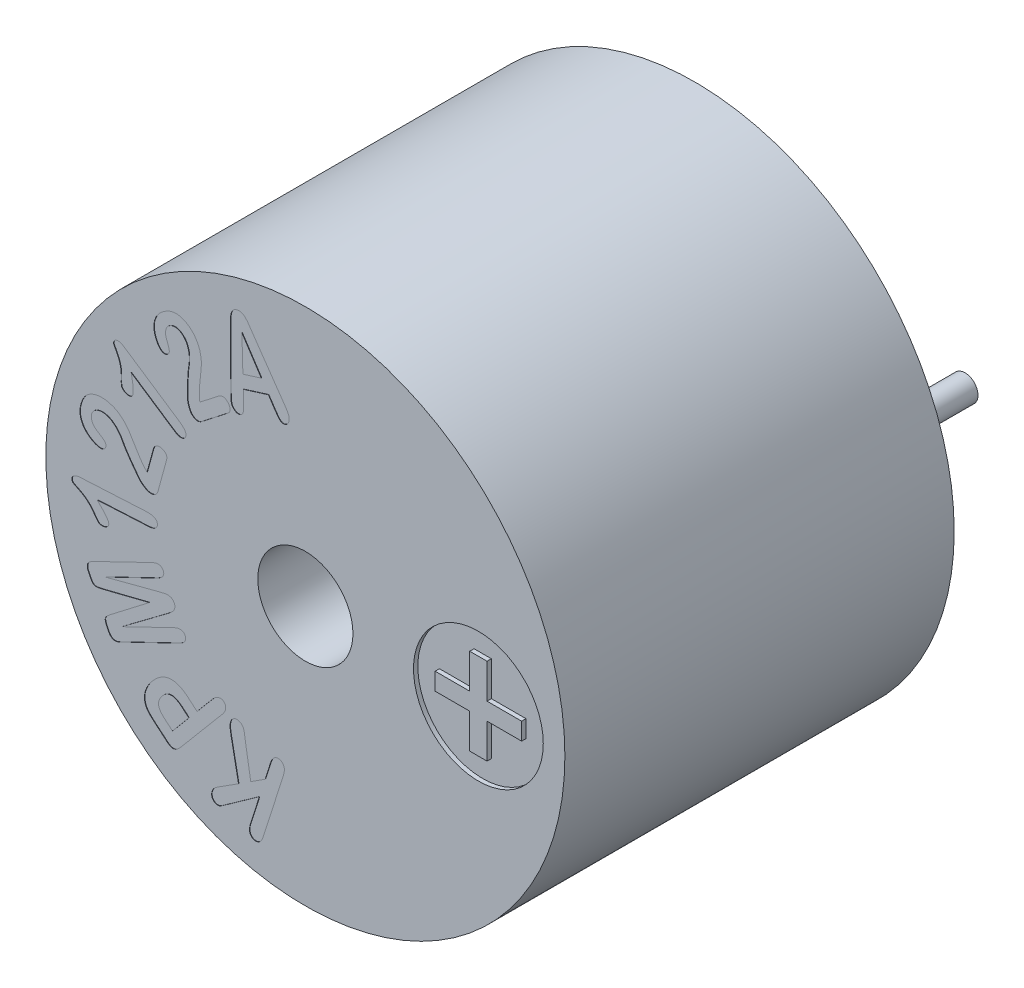
from build123d import *

# Parameters (mm, degrees)
SKETCH_1_R              = 6
SKETCH_1_R_2            = 5
EXTRUDE_1_DEPTH         = 0.5
EXTRUDE_START           = 0.5
SKETCH_1_3_R            = 6
EXTRUDE_2_DEPTH         = 8.5
CUT_EXTRUDE_START       = 9
SKETCH_1_4_R            = 1.1
CUT_EXTRUDE_1_DEPTH     = 3
EXTRUDE_3_DEPTH         = 0.5
EXTRUDE_3_DEPTH_BACK    = 3
SKETCH_2_R              = 0.3
EXTRUDE_3_2_DEPTH       = 0.5
EXTRUDE_3_2_DEPTH_BACK  = 3
CUT_EXTRUDE_START_2     = 8.9
CUT_EXTRUDE_2_OUTLINE_R = 1.5
CUT_EXTRUDE_2_DEPTH     = 0.1
WRAP_START              = 8.99
WRAP_1_DEPTH            = 0.01


# Read off the part's stored shape, not the designer's step: Вырез-Вытянуть2, Перенос1
with BuildPart() as part:
    # Эскиз1 → Бобышка-Вытянуть1 (new body)
    with BuildSketch(Plane.XY):
        Circle(SKETCH_1_R)
        Circle(SKETCH_1_R_2, mode=Mode.SUBTRACT)
    extrude(amount=EXTRUDE_1_DEPTH)

    # Эскиз1<3> → Бобышка-Вытянуть2 (add)
    with BuildSketch(Plane.XY.offset(EXTRUDE_START)):
        Circle(SKETCH_1_3_R)
    extrude(amount=EXTRUDE_2_DEPTH)

    # Эскиз1<4> → Вырез-Вытянуть1 (cut)
    with BuildSketch(Plane.XY.offset(CUT_EXTRUDE_START)):
        Circle(SKETCH_1_4_R)
    extrude(amount=-CUT_EXTRUDE_1_DEPTH, mode=Mode.SUBTRACT)

    # Вырез-Вытянуть2 outline → Вырез-Вытянуть2 (cut)
    with BuildSketch(Plane.XY.offset(CUT_EXTRUDE_START_2)):
        with Locations((4, 0)):
            Circle(CUT_EXTRUDE_2_OUTLINE_R)
        Polygon((3, 0.2), (3.8, 0.2), (3.8, 1), (4.2, 1), (4.2, 0.2), (5, 0.2), (5, -0.2), (4.2, -0.2), (4.2, -1), (3.8, -1), (3.8, -0.2), (3, -0.2), align=None, mode=Mode.SUBTRACT)
    extrude(amount=CUT_EXTRUDE_2_DEPTH, mode=Mode.SUBTRACT)

    # Перенос1 outline → Перенос1 (cut)
    # profile 1 of 8: a face of its own
    with BuildSketch(Plane.XY.offset(WRAP_START)):
        with BuildLine():
            add(Edge.make_bspline(
                [(-1.428605394, 3.36679184), (-1.428449227, 3.354682746), (-1.428148656, 3.331376643), (-1.4281313, 3.297909794), (-1.428553274, 3.267310229), (-1.429139913, 3.239685942), (-1.430804785, 3.214946984), (-1.432693406, 3.193190317), (-1.434925091, 3.174253639), (-1.438761833, 3.153542847), (-1.446833689, 3.130896779), (-1.463354686, 3.108057862), (-1.487208656, 3.090856597), (-1.50586995, 3.083797263), (-1.515714769, 3.08007309)],
                knots=[0, 0, 0, 0, 0.111882552, 0.215337857, 0.309177123, 0.394621777, 0.470561407, 0.538195639, 0.596387499, 0.646639346, 0.732666325, 0.816157896, 0.903013566, 1, 1, 1, 1], degree=3))
            Line((-1.428605394, 3.36679184), (-1.434855394, 3.626557465))
            Line((-1.434855394, 3.626557465), (-0.853996019, 3.80741684))
            Line((-0.853996019, 3.80741684), (-0.713371019, 3.595307465))
            add(Edge.make_bspline(
                [(-0.470402269, 3.40585434), (-0.481258824, 3.403037119), (-0.502084122, 3.397633059), (-0.53418255, 3.401619184), (-0.562660273, 3.414651715), (-0.585041676, 3.430131483), (-0.602233221, 3.447112163), (-0.616603302, 3.463855261), (-0.633068003, 3.483542315), (-0.655535003, 3.514150775), (-0.682599454, 3.551660731), (-0.703628437, 3.581488477), (-0.713371019, 3.595307465)],
                knots=[0, 0, 0, 0, 0.100723766, 0.193210704, 0.285547501, 0.381949588, 0.437760874, 0.503692542, 0.581515187, 0.669858793, 0.847047871, 1, 1, 1, 1], degree=3))
            add(Edge.make_bspline(
                [(-0.382121019, 3.61991684), (-0.379392544, 3.609304548), (-0.373963416, 3.588188173), (-0.372673952, 3.555349296), (-0.376603793, 3.522199774), (-0.386324907, 3.489971488), (-0.400029958, 3.459964121), (-0.419282038, 3.435547578), (-0.442571877, 3.416381412), (-0.461022137, 3.409402452), (-0.470402269, 3.40585434)],
                knots=[0, 0, 0, 0, 0.128587242, 0.255863317, 0.383911215, 0.519617438, 0.65046537, 0.769354858, 0.882739756, 1, 1, 1, 1], degree=3))
            add(Edge.make_bspline(
                [(-0.487199144, 3.803119965), (-0.474102972, 3.784239329), (-0.449941858, 3.749406465), (-0.419660786, 3.699778568), (-0.396113555, 3.658189334), (-0.386403105, 3.631629236), (-0.382121019, 3.61991684)],
                knots=[0, 0, 0, 0, 0.325275177, 0.600099818, 0.823653169, 1, 1, 1, 1], degree=3))
            Line((-0.487199144, 3.803119965), (-1.229777269, 4.872651215))
            add(Edge.make_bspline(
                [(-1.589542894, 5.141401215), (-1.579713155, 5.144186494), (-1.560806479, 5.149543742), (-1.532148848, 5.15231906), (-1.504938929, 5.150432166), (-1.479200596, 5.143933139), (-1.455014038, 5.134088521), (-1.4321272, 5.1214143), (-1.410490081, 5.106100811), (-1.383479799, 5.081720051), (-1.351703677, 5.047278402), (-1.322300062, 5.008855266), (-1.298871887, 4.974025629), (-1.2779856, 4.943943104), (-1.25467164, 4.909701799), (-1.238357253, 4.885420905), (-1.229777269, 4.872651215)],
                knots=[0, 0, 0, 0, 0.062873549, 0.120931978, 0.176455405, 0.230180524, 0.283833658, 0.33699834, 0.391111716, 0.446832015, 0.560971045, 0.679441093, 0.744667931, 0.819691191, 0.905172866, 1, 1, 1, 1], degree=3))
            add(Edge.make_bspline(
                [(-1.729777269, 4.71444809), (-1.730067759, 4.735021245), (-1.730702033, 4.779942038), (-1.73096359, 4.837488478), (-1.730979269, 4.886224286), (-1.728734386, 4.92124455), (-1.72633073, 4.95349311), (-1.721993506, 4.982992153), (-1.716136528, 5.010452461), (-1.706276027, 5.035445041), (-1.69516314, 5.059338801), (-1.680668103, 5.081270432), (-1.662968542, 5.10096052), (-1.641948858, 5.11815017), (-1.617123633, 5.131815613), (-1.598896183, 5.138150508), (-1.589542894, 5.141401215)],
                knots=[0, 0, 0, 0, 0.126739608, 0.276731677, 0.354538072, 0.426837051, 0.492847246, 0.553647206, 0.610459527, 0.665283676, 0.718735295, 0.772570687, 0.826525448, 0.881267392, 0.939073197, 1, 1, 1, 1], degree=3))
            Line((-1.729777269, 4.71444809), (-1.723527269, 3.407026215))
            add(Edge.make_bspline(
                [(-1.706339769, 3.20507309), (-1.709785069, 3.21802872), (-1.716808151, 3.244438164), (-1.720721243, 3.279591235), (-1.722108353, 3.310790916), (-1.722742065, 3.339057703), (-1.723764961, 3.371603406), (-1.723609406, 3.39478558), (-1.723527269, 3.407026215)],
                knots=[0, 0, 0, 0, 0.197480304, 0.402554355, 0.519832606, 0.658145621, 0.819494301, 1, 1, 1, 1], degree=3))
            add(Edge.make_bspline(
                [(-1.515714769, 3.08007309), (-1.524776616, 3.077878689), (-1.543024596, 3.073459791), (-1.571833332, 3.076028492), (-1.600773193, 3.085017296), (-1.629046104, 3.100581943), (-1.655072116, 3.121319857), (-1.677417577, 3.145870466), (-1.694990887, 3.173933258), (-1.702531392, 3.194623407), (-1.706339769, 3.20507309)],
                knots=[0, 0, 0, 0, 0.110912716, 0.223346641, 0.340629655, 0.471672739, 0.606944102, 0.737095221, 0.867218368, 1, 1, 1, 1], degree=3))
        make_face()
        Polygon((-1.466886644, 4.74101059), (-1.017667894, 4.057807465), (-1.444230394, 3.924994965), align=None, mode=Mode.SUBTRACT)
    # profile 2 of 8: a face of its own
    with BuildSketch(Plane.XY.offset(WRAP_START)):
        with BuildLine():
            add(Edge.make_bspline(
                [(-4.026173614, 2.662677904), (-4.020107979, 2.633419608), (-4.008653457, 2.578167381), (-3.99556939, 2.499411371), (-3.985351965, 2.429926848), (-3.979678779, 2.369443917), (-3.97815223, 2.318081625), (-3.980709027, 2.276036347), (-3.986084248, 2.242261544), (-3.994949615, 2.224401325), (-3.998829864, 2.216584154)],
                knots=[0, 0, 0, 0, 0.197915371, 0.373749199, 0.528788604, 0.663026882, 0.776049531, 0.86853883, 0.942461261, 1, 1, 1, 1], degree=3))
            Line((-4.026173614, 2.662677904), (-3.028907989, 1.997443529))
            add(Edge.make_bspline(
                [(-2.776954864, 1.990412279), (-2.782800373, 1.982591149), (-2.79417269, 1.967375301), (-2.818219826, 1.95128516), (-2.845699488, 1.941474843), (-2.876958689, 1.938036274), (-2.911390147, 1.941889987), (-2.948453715, 1.953596387), (-2.988680648, 1.971593969), (-3.014930994, 1.988462096), (-3.028907989, 1.997443529)],
                knots=[0, 0, 0, 0, 0.103247739, 0.200866345, 0.302549706, 0.411338273, 0.532522872, 0.668418114, 0.823449232, 1, 1, 1, 1], degree=3))
            add(Edge.make_bspline(
                [(-2.922267364, 2.251349779), (-2.90513232, 2.239521882), (-2.873090572, 2.217404256), (-2.831213849, 2.182244897), (-2.798626727, 2.147950079), (-2.77527626, 2.114456074), (-2.760593892, 2.081881893), (-2.755829067, 2.04965672), (-2.760899126, 2.018019489), (-2.771500887, 1.999790178), (-2.776954864, 1.990412279)],
                knots=[0, 0, 0, 0, 0.187645064, 0.350887666, 0.492094085, 0.61289707, 0.717563266, 0.811200165, 0.902873684, 1, 1, 1, 1], degree=3))
            Line((-2.922267364, 2.251349779), (-4.181642364, 3.091584154))
            add(Edge.make_bspline(
                [(-4.416017364, 3.107599779), (-4.410758841, 3.114201869), (-4.400293329, 3.127341349), (-4.378260676, 3.140939349), (-4.352161225, 3.147907223), (-4.322614342, 3.148669783), (-4.289990394, 3.143789719), (-4.255156527, 3.132546687), (-4.218420777, 3.114945296), (-4.19437399, 3.099671108), (-4.181642364, 3.091584154)],
                knots=[0, 0, 0, 0, 0.096819302, 0.192689774, 0.292572897, 0.405341812, 0.531336226, 0.671509548, 0.826079977, 1, 1, 1, 1], degree=3))
            add(Edge.make_bspline(
                [(-4.255470489, 2.434943529), (-4.254904875, 2.458771642), (-4.253810037, 2.504894853), (-4.257203186, 2.571899927), (-4.265448801, 2.634154515), (-4.27759081, 2.69240857), (-4.294117142, 2.747835438), (-4.313562224, 2.802137908), (-4.336732297, 2.855851933), (-4.358689237, 2.899296267), (-4.376669628, 2.932674334), (-4.388436547, 2.955441795), (-4.399403688, 2.975537842), (-4.408023872, 2.993498311), (-4.416195259, 3.008749937), (-4.422162866, 3.021781135), (-4.427035425, 3.032303523), (-4.431886074, 3.042875578), (-4.434928938, 3.056046793), (-4.432839257, 3.072492088), (-4.426747511, 3.090185598), (-4.419790145, 3.101476853), (-4.416017364, 3.107599779)],
                knots=[0, 0, 0, 0, 0.100476492, 0.194488697, 0.282540815, 0.365021682, 0.445112634, 0.526213365, 0.608107433, 0.691587225, 0.731375013, 0.767966219, 0.799647997, 0.827883809, 0.851946884, 0.872577148, 0.888298662, 0.900842277, 0.921625387, 0.944242041, 0.969764048, 1, 1, 1, 1], degree=3))
            add(Edge.make_bspline(
                [(-4.185548614, 2.206818529), (-4.194382354, 2.213035803), (-4.210989575, 2.224724132), (-4.230893624, 2.245666892), (-4.244786003, 2.267554043), (-4.252762794, 2.291575795), (-4.25487723, 2.319162326), (-4.257210412, 2.351824427), (-4.256703403, 2.391210311), (-4.255903518, 2.419583363), (-4.255470489, 2.434943529)],
                knots=[0, 0, 0, 0, 0.127372285, 0.239456873, 0.33892401, 0.431349793, 0.535147644, 0.664593107, 0.818422574, 1, 1, 1, 1], degree=3))
            add(Edge.make_bspline(
                [(-3.998829864, 2.216584154), (-4.003345932, 2.210794726), (-4.01229294, 2.199325001), (-4.031744333, 2.187351446), (-4.054429803, 2.179116342), (-4.080507492, 2.176117587), (-4.107709333, 2.176610017), (-4.134805549, 2.182469098), (-4.161192445, 2.192023663), (-4.177358583, 2.201843592), (-4.185548614, 2.206818529)],
                knots=[0, 0, 0, 0, 0.106499064, 0.210990636, 0.328356804, 0.456981303, 0.592125119, 0.724220951, 0.860285804, 1, 1, 1, 1], degree=3))
        make_face()
    # profile 3 of 8: a face of its own
    with BuildSketch(Plane.XY.offset(WRAP_START)):
        with BuildLine():
            add(Edge.make_bspline(
                [(-2.011158725, 3.200717838), (-2.000839247, 3.208115422), (-1.981220372, 3.222179339), (-1.949609834, 3.236624018), (-1.918299285, 3.243673838), (-1.887676784, 3.243276944), (-1.858249219, 3.236014127), (-1.830329717, 3.222459682), (-1.804675509, 3.202053687), (-1.790172288, 3.184974787), (-1.7826431, 3.176108463)],
                knots=[0, 0, 0, 0, 0.145797013, 0.277181993, 0.396741784, 0.512071317, 0.626129693, 0.742678041, 0.866414114, 1, 1, 1, 1], degree=3))
            Line((-2.011158725, 3.200717838), (-2.43811185, 2.868295963))
            add(Edge.make_bspline(
                [(-2.451002475, 2.967124088), (-2.449825, 2.951596643), (-2.447309584, 2.918425648), (-2.441305437, 2.885701719), (-2.43811185, 2.868295963)],
                knots=[0, 0, 0, 0, 0.468103099, 1, 1, 1, 1], degree=3))
            add(Edge.make_bspline(
                [(-2.55998685, 4.133139713), (-2.544423116, 4.111831443), (-2.513825718, 4.069940619), (-2.476429087, 4.002687973), (-2.448219161, 3.933186513), (-2.428720334, 3.862867807), (-2.416109828, 3.794742173), (-2.407134053, 3.731020945), (-2.402921824, 3.672652959), (-2.403886249, 3.626462338), (-2.406093197, 3.589633964), (-2.408423094, 3.558898567), (-2.411688885, 3.5244165), (-2.415211344, 3.486005862), (-2.418988123, 3.443663266), (-2.423707091, 3.397569993), (-2.429308622, 3.347728732), (-2.435066441, 3.295271117), (-2.440361331, 3.242661263), (-2.445198029, 3.19255367), (-2.448753099, 3.146191228), (-2.450999803, 3.103335605), (-2.452774609, 3.064143712), (-2.453003327, 3.028454543), (-2.452925024, 2.996525008), (-2.451615294, 2.976495736), (-2.451002475, 2.967124088)],
                knots=[0, 0, 0, 0, 0.065792442, 0.129344126, 0.191423065, 0.252515712, 0.31107044, 0.364183798, 0.413023696, 0.456887062, 0.479341291, 0.505080583, 0.533787756, 0.565759796, 0.601320231, 0.639853575, 0.681363039, 0.726460295, 0.771523603, 0.813290353, 0.852061265, 0.887526595, 0.920365013, 0.949930711, 0.976572702, 1, 1, 1, 1], degree=3))
            add(Edge.make_bspline(
                [(-3.0498306, 4.363999088), (-3.035918388, 4.365629975), (-3.00789304, 4.368915303), (-2.965013378, 4.367826991), (-2.921609769, 4.362270263), (-2.877683065, 4.352413477), (-2.833797238, 4.338352833), (-2.790207315, 4.320355904), (-2.747472491, 4.297969007), (-2.706073, 4.271336026), (-2.665625566, 4.241897561), (-2.627987061, 4.20844591), (-2.592012979, 4.172694875), (-2.570694918, 4.146365144), (-2.55998685, 4.133139713)],
                knots=[0, 0, 0, 0, 0.074184683, 0.149440772, 0.226671865, 0.305888876, 0.387756451, 0.470699602, 0.555610126, 0.643126744, 0.731488691, 0.820519517, 0.909846904, 1, 1, 1, 1], degree=3))
            add(Edge.make_bspline(
                [(-3.300221225, 4.244858463), (-3.27972522, 4.260088336), (-3.240122423, 4.289515808), (-3.176883346, 4.323983552), (-3.11391024, 4.349883912), (-3.070836822, 4.359371931), (-3.0498306, 4.363999088)],
                knots=[0, 0, 0, 0, 0.273322864, 0.528120018, 0.769871623, 1, 1, 1, 1], degree=3))
            add(Edge.make_bspline(
                [(-3.38029935, 3.502670963), (-3.389252976, 3.514755538), (-3.407385518, 3.539228758), (-3.430687175, 3.579388019), (-3.451443145, 3.622668088), (-3.469641071, 3.668686862), (-3.484551576, 3.716662922), (-3.494657528, 3.765869569), (-3.500641022, 3.815650306), (-3.501841668, 3.866019208), (-3.497994021, 3.916567069), (-3.488570496, 3.967037214), (-3.473138736, 4.016976935), (-3.452523049, 4.066613783), (-3.425023101, 4.114885198), (-3.390324702, 4.161104742), (-3.348708169, 4.205240911), (-3.316683735, 4.231407329), (-3.300221225, 4.244858463)],
                knots=[0, 0, 0, 0, 0.054085435, 0.109531761, 0.166741634, 0.226689132, 0.287455001, 0.347276026, 0.40719422, 0.467652229, 0.528275229, 0.589293464, 0.651988605, 0.716034791, 0.782344383, 0.851313734, 0.923566195, 1, 1, 1, 1], degree=3))
            add(Edge.make_bspline(
                [(-3.187721225, 3.451108463), (-3.194539746, 3.446268015), (-3.207981424, 3.436725807), (-3.231787122, 3.429664248), (-3.256647385, 3.427002488), (-3.282677226, 3.430851622), (-3.308821446, 3.440293603), (-3.334288781, 3.455649708), (-3.358642241, 3.476570835), (-3.372866366, 3.493713081), (-3.38029935, 3.502670963)],
                knots=[0, 0, 0, 0, 0.11172834, 0.220255426, 0.329317894, 0.445946256, 0.570555191, 0.700876173, 0.843689331, 1, 1, 1, 1], degree=3))
            add(Edge.make_bspline(
                [(-3.2248306, 3.790561588), (-3.223594448, 3.785594051), (-3.220398458, 3.772750812), (-3.212179377, 3.750103033), (-3.20102045, 3.719340238), (-3.185747121, 3.683432516), (-3.170688878, 3.645103739), (-3.158297734, 3.608317949), (-3.150504996, 3.574664486), (-3.145584517, 3.544533839), (-3.145832523, 3.516760576), (-3.153109881, 3.491478824), (-3.167208024, 3.468872096), (-3.180729033, 3.457163429), (-3.187721225, 3.451108463)],
                knots=[0, 0, 0, 0, 0.041956492, 0.108475743, 0.197331467, 0.31035323, 0.42833518, 0.535036872, 0.628275408, 0.711328004, 0.785034706, 0.853969642, 0.924482541, 1, 1, 1, 1], degree=3))
            add(Edge.make_bspline(
                [(-3.149439975, 4.040952213), (-3.157881073, 4.033772626), (-3.174438341, 4.019689821), (-3.194971678, 3.994593555), (-3.211356275, 3.967023211), (-3.222408701, 3.936472704), (-3.230199491, 3.903715869), (-3.232390865, 3.868199673), (-3.231553134, 3.830048481), (-3.227130017, 3.804067931), (-3.2248306, 3.790561588)],
                knots=[0, 0, 0, 0, 0.120067532, 0.235513217, 0.350160321, 0.466442049, 0.586775438, 0.714351532, 0.851501746, 1, 1, 1, 1], degree=3))
            add(Edge.make_bspline(
                [(-2.784596225, 3.956967838), (-2.793212166, 3.967600858), (-2.810070982, 3.988406493), (-2.838860624, 4.015323627), (-2.869080991, 4.038386015), (-2.901121742, 4.056624818), (-2.9339176, 4.070653571), (-2.966851984, 4.080811598), (-3.000066382, 4.085476698), (-3.032907399, 4.085391442), (-3.064774316, 4.081306483), (-3.095172237, 4.072458611), (-3.123826523, 4.059403116), (-3.14089581, 4.047107086), (-3.149439975, 4.040952213)],
                knots=[0, 0, 0, 0, 0.098371315, 0.192483197, 0.282801723, 0.371353553, 0.456977278, 0.539089491, 0.618589123, 0.697289744, 0.774804717, 0.848933359, 0.924382424, 1, 1, 1, 1], degree=3))
            add(Edge.make_bspline(
                [(-2.69904935, 3.428842838), (-2.696024752, 3.447178354), (-2.690121275, 3.482966026), (-2.68414205, 3.535881025), (-2.681447784, 3.586750803), (-2.681403545, 3.635648697), (-2.683968874, 3.682774789), (-2.689925949, 3.72803562), (-2.698397361, 3.771691941), (-2.710164906, 3.813446992), (-2.724559053, 3.853122353), (-2.741231388, 3.890577745), (-2.761252573, 3.925203485), (-2.7768477, 3.946424207), (-2.784596225, 3.956967838)],
                knots=[0, 0, 0, 0, 0.101201923, 0.197528192, 0.289853039, 0.378498513, 0.463742833, 0.546690749, 0.626939142, 0.705745717, 0.78269244, 0.856642958, 0.928772272, 1, 1, 1, 1], degree=3))
            add(Edge.make_bspline(
                [(-2.724439975, 2.798764713), (-2.724773764, 2.835482959), (-2.725420031, 2.906575114), (-2.725160534, 3.009712119), (-2.72317078, 3.105685203), (-2.720514796, 3.180940732), (-2.717989954, 3.236672876), (-2.715564564, 3.274163101), (-2.713182603, 3.308274012), (-2.71104337, 3.339035101), (-2.708156644, 3.366355392), (-2.705631756, 3.390231571), (-2.702439947, 3.410659554), (-2.700116772, 3.423118407), (-2.69904935, 3.428842838)],
                knots=[0, 0, 0, 0, 0.17450677, 0.337871874, 0.490128796, 0.63068423, 0.695732147, 0.755253125, 0.809216843, 0.858243052, 0.901775288, 0.93976998, 0.972326299, 1, 1, 1, 1], degree=3))
            add(Edge.make_bspline(
                [(-2.640064975, 2.544858463), (-2.645060116, 2.551911792), (-2.655919969, 2.567246315), (-2.669448822, 2.594595976), (-2.683596904, 2.626576277), (-2.696684058, 2.662486268), (-2.708100125, 2.699502826), (-2.716762245, 2.735100767), (-2.722559175, 2.767859189), (-2.72383658, 2.788849668), (-2.724439975, 2.798764713)],
                knots=[0, 0, 0, 0, 0.095733213, 0.208131941, 0.33746805, 0.48368393, 0.631700373, 0.766910298, 0.889897948, 1, 1, 1, 1], degree=3))
            add(Edge.make_bspline(
                [(-2.39592435, 2.499936588), (-2.406059428, 2.492790598), (-2.425522176, 2.479067902), (-2.458706515, 2.467116041), (-2.492554623, 2.462930096), (-2.526477959, 2.467557536), (-2.558749636, 2.479235359), (-2.589104929, 2.495597829), (-2.616757404, 2.517575573), (-2.632149042, 2.535592396), (-2.640064975, 2.544858463)],
                knots=[0, 0, 0, 0, 0.133290826, 0.255963074, 0.376205767, 0.498014143, 0.621536232, 0.744762344, 0.868731053, 1, 1, 1, 1], degree=3))
            Line((-2.39592435, 2.499936588), (-1.7935806, 2.968686588))
            add(Edge.make_bspline(
                [(-1.7826431, 3.176108463), (-1.776359794, 3.167570244), (-1.764163193, 3.1509966), (-1.751190468, 3.123706143), (-1.743244266, 3.095839009), (-1.739888818, 3.06783143), (-1.742315437, 3.03985342), (-1.752548523, 3.013354688), (-1.769899483, 2.98896873), (-1.785440914, 2.975657976), (-1.7935806, 2.968686588)],
                knots=[0, 0, 0, 0, 0.1353095, 0.262650956, 0.383858545, 0.504470065, 0.621595335, 0.739098658, 0.86335526, 1, 1, 1, 1], degree=3))
        make_face()
    # profile 4 of 8: a face of its own
    with BuildSketch(Plane.XY.offset(WRAP_START)):
        with BuildLine():
            add(Edge.make_bspline(
                [(-3.515497384, 1.382368171), (-3.511732051, 1.394501301), (-3.504576215, 1.417559732), (-3.488090445, 1.448212), (-3.467420856, 1.472700494), (-3.443107809, 1.491084594), (-3.415620311, 1.503493733), (-3.385572827, 1.509204099), (-3.353265992, 1.508823289), (-3.331838213, 1.50377278), (-3.320575509, 1.501118171)],
                knots=[0, 0, 0, 0, 0.146821461, 0.279027128, 0.399847111, 0.51500589, 0.629024602, 0.745789961, 0.866384077, 1, 1, 1, 1], degree=3))
            Line((-3.515497384, 1.382368171), (-3.658466134, 0.859711921))
            add(Edge.make_bspline(
                [(-3.727997384, 0.931586921), (-3.717760917, 0.919824842), (-3.695849413, 0.894647717), (-3.671460957, 0.871855972), (-3.658466134, 0.859711921)],
                knots=[0, 0, 0, 0, 0.467173223, 1, 1, 1, 1], degree=3))
            add(Edge.make_bspline(
                [(-4.523700509, 1.803461921), (-4.498101526, 1.795699636), (-4.447882521, 1.780471914), (-4.377176634, 1.748203646), (-4.311647575, 1.710156446), (-4.253633657, 1.664600563), (-4.20179139, 1.617363751), (-4.155809387, 1.571505457), (-4.117189113, 1.526913503), (-4.08999725, 1.489356627), (-4.069854368, 1.458195183), (-4.052973014, 1.432156853), (-4.034827247, 1.40238329), (-4.014353307, 1.369540855), (-3.992125941, 1.333188405), (-3.967915477, 1.293339656), (-3.941787695, 1.250161507), (-3.914731158, 1.204547165), (-3.887371447, 1.159081423), (-3.860384937, 1.116208371), (-3.83500899, 1.076743007), (-3.811238834, 1.040670865), (-3.788594802, 1.008222957), (-3.76726364, 0.97940754), (-3.747193555, 0.954243564), (-3.734151283, 0.938850176), (-3.727997384, 0.931586921)],
                knots=[0, 0, 0, 0, 0.066164335, 0.1297984, 0.191944298, 0.25333047, 0.311991225, 0.36556243, 0.414027499, 0.457876579, 0.480230661, 0.505896221, 0.534704152, 0.566553425, 0.601718505, 0.640199967, 0.681998253, 0.726671534, 0.771510851, 0.813372495, 0.852093586, 0.887680258, 0.920324012, 0.950048175, 0.976430603, 1, 1, 1, 1], degree=3))
            add(Edge.make_bspline(
                [(-5.058856759, 1.696430671), (-5.048503491, 1.706035131), (-5.027677755, 1.72535463), (-4.992647192, 1.750346245), (-4.954451223, 1.771837647), (-4.913321799, 1.790340012), (-4.869392979, 1.804822982), (-4.823357558, 1.816459718), (-4.775332481, 1.823565213), (-4.725731966, 1.827647263), (-4.67520936, 1.827364742), (-4.624334968, 1.824275943), (-4.573726044, 1.815754001), (-4.540449216, 1.807577348), (-4.523700509, 1.803461921)],
                knots=[0, 0, 0, 0, 0.074249055, 0.149352949, 0.225748814, 0.304564015, 0.38624243, 0.46882668, 0.554095476, 0.641374585, 0.730439729, 0.819718058, 0.9092615, 1, 1, 1, 1], degree=3))
            add(Edge.make_bspline(
                [(-5.189325509, 1.451118171), (-5.181943737, 1.47554256), (-5.167642793, 1.522860717), (-5.137626702, 1.588379853), (-5.102353004, 1.646917201), (-5.073163407, 1.680144856), (-5.058856759, 1.696430671)],
                knots=[0, 0, 0, 0, 0.272511847, 0.52794599, 0.768632968, 1, 1, 1, 1], degree=3))
            add(Edge.make_bspline(
                [(-4.802216134, 0.806196296), (-4.816750508, 0.81064987), (-4.84625048, 0.819689154), (-4.889759063, 0.837904794), (-4.933027218, 0.860254102), (-4.975875879, 0.886255536), (-5.016963883, 0.915946657), (-5.055177134, 0.949525071), (-5.090193673, 0.986127207), (-5.122165745, 1.02575483), (-5.150048547, 1.068629963), (-5.17263967, 1.115051503), (-5.190747546, 1.16436801), (-5.204244157, 1.216628168), (-5.211171414, 1.271993372), (-5.211606296, 1.329829895), (-5.204416716, 1.390148474), (-5.194459689, 1.430375669), (-5.189325509, 1.451118171)],
                knots=[0, 0, 0, 0, 0.05424829, 0.110106089, 0.168114323, 0.22799069, 0.288897694, 0.348855217, 0.409354575, 0.469542345, 0.530406755, 0.591531592, 0.653452082, 0.717720617, 0.783801337, 0.852140982, 0.923758895, 1, 1, 1, 1], degree=3))
            add(Edge.make_bspline(
                [(-4.615106759, 0.879633796), (-4.617715427, 0.871769209), (-4.622895744, 0.856151638), (-4.637478998, 0.836014291), (-4.656475885, 0.819507049), (-4.679726346, 0.807149567), (-4.706475765, 0.798911317), (-4.736303244, 0.795858446), (-4.768701273, 0.798548386), (-4.790681076, 0.803564058), (-4.802216134, 0.806196296)],
                knots=[0, 0, 0, 0, 0.11015742, 0.218751656, 0.327248317, 0.444006941, 0.567809978, 0.699017743, 0.842043719, 1, 1, 1, 1], degree=3))
            add(Edge.make_bspline(
                [(-4.850653634, 1.130024421), (-4.846655235, 1.126847118), (-4.836264049, 1.118589828), (-4.815892428, 1.105454084), (-4.788140834, 1.087701909), (-4.75430274, 1.06760408), (-4.718826804, 1.046079951), (-4.686823188, 1.023533587), (-4.659952524, 1.001578355), (-4.63795312, 0.980265814), (-4.621408367, 0.95791916), (-4.611369342, 0.933393766), (-4.60967843, 0.906486221), (-4.613248538, 0.888825896), (-4.615106759, 0.879633796)],
                knots=[0, 0, 0, 0, 0.041582104, 0.108065093, 0.197222276, 0.310000179, 0.428612207, 0.53514224, 0.628575259, 0.711073979, 0.784065997, 0.85359279, 0.923795868, 1, 1, 1, 1], degree=3))
            add(Edge.make_bspline(
                [(-4.941278634, 1.376508796), (-4.94367272, 1.365752022), (-4.948392049, 1.344547784), (-4.950026015, 1.312080135), (-4.946040219, 1.280137452), (-4.9366505, 1.248813051), (-4.923009408, 1.21780974), (-4.90396482, 1.18741382), (-4.879300586, 1.158111089), (-4.860452246, 1.139631389), (-4.850653634, 1.130024421)],
                knots=[0, 0, 0, 0, 0.118997931, 0.234574086, 0.349470907, 0.465303993, 0.586945639, 0.714682827, 0.851673296, 1, 1, 1, 1], degree=3))
            add(Edge.make_bspline(
                [(-4.596356759, 1.527680671), (-4.609712734, 1.530951074), (-4.635814788, 1.537342539), (-4.675256836, 1.542112308), (-4.713671973, 1.542100213), (-4.750739911, 1.537776958), (-4.78583043, 1.529796551), (-4.818312777, 1.517594972), (-4.847791222, 1.501402766), (-4.874442759, 1.481950055), (-4.897382435, 1.459366979), (-4.916672459, 1.434253097), (-4.931641616, 1.406539719), (-4.938064647, 1.38652424), (-4.941278634, 1.376508796)],
                knots=[0, 0, 0, 0, 0.098359497, 0.192227442, 0.283562764, 0.372693663, 0.458826163, 0.540528528, 0.620190769, 0.698854519, 0.775962515, 0.849778486, 0.924831421, 1, 1, 1, 1], degree=3))
            add(Edge.make_bspline(
                [(-4.207684884, 1.154633796), (-4.216213271, 1.171278122), (-4.232839543, 1.203726593), (-4.260532451, 1.249575423), (-4.288829037, 1.292264204), (-4.318725671, 1.331295955), (-4.349134494, 1.367624674), (-4.381270213, 1.400362241), (-4.414500608, 1.430347593), (-4.449312808, 1.456692171), (-4.484672089, 1.480408749), (-4.521277967, 1.499874722), (-4.558260195, 1.516235818), (-4.583765604, 1.523898075), (-4.596356759, 1.527680671)],
                knots=[0, 0, 0, 0, 0.101141576, 0.197177665, 0.289582966, 0.378054773, 0.46301352, 0.545699344, 0.626014005, 0.704907606, 0.781684926, 0.856059486, 0.928941451, 1, 1, 1, 1], degree=3))
            add(Edge.make_bspline(
                [(-3.846747384, 0.633149421), (-3.869380545, 0.66249557), (-3.91310333, 0.719186522), (-3.974732634, 0.802661868), (-4.031502389, 0.880608768), (-4.074861037, 0.942521977), (-4.106428668, 0.988804892), (-4.126997266, 1.020492517), (-4.14575841, 1.049391321), (-4.162598442, 1.075453941), (-4.177097031, 1.098872607), (-4.18926131, 1.119754178), (-4.199497291, 1.137884265), (-4.205127094, 1.14940127), (-4.207684884, 1.154633796)],
                knots=[0, 0, 0, 0, 0.17512232, 0.338301656, 0.49030022, 0.630785057, 0.695464568, 0.755024664, 0.809296609, 0.85828145, 0.901654513, 0.939434018, 0.972483031, 1, 1, 1, 1], degree=3))
            add(Edge.make_bspline(
                [(-3.629559884, 0.481196296), (-3.637697194, 0.483897624), (-3.655406761, 0.489776638), (-3.682604084, 0.503053807), (-3.712704373, 0.520335887), (-3.74428165, 0.541231662), (-3.775507459, 0.563660137), (-3.80302451, 0.587334776), (-3.82734645, 0.609522106), (-3.840528764, 0.625576111), (-3.846747384, 0.633149421)],
                knots=[0, 0, 0, 0, 0.095876695, 0.208660459, 0.33790696, 0.484232871, 0.632311855, 0.767784444, 0.890454724, 1, 1, 1, 1], degree=3))
            add(Edge.make_bspline(
                [(-3.409247384, 0.591743171), (-3.41302771, 0.58005625), (-3.420355883, 0.557401119), (-3.439583378, 0.528046664), (-3.464162066, 0.504372547), (-3.49399056, 0.487961263), (-3.526465688, 0.477700807), (-3.560212859, 0.472237971), (-3.595030372, 0.47357958), (-3.617899811, 0.478624251), (-3.629559884, 0.481196296)],
                knots=[0, 0, 0, 0, 0.13300993, 0.257840154, 0.376964321, 0.5005448, 0.624068541, 0.745762683, 0.870376111, 1, 1, 1, 1], degree=3))
            Line((-3.409247384, 0.591743171), (-3.207294259, 1.329243171))
            add(Edge.make_bspline(
                [(-3.320575509, 1.501118171), (-3.310545564, 1.498069539), (-3.291187214, 1.492185512), (-3.264940877, 1.478007299), (-3.241941058, 1.460912282), (-3.223204693, 1.440052733), (-3.208424411, 1.416556546), (-3.2010015, 1.389380563), (-3.200260594, 1.359633366), (-3.204867715, 1.339727483), (-3.207294259, 1.329243171)],
                knots=[0, 0, 0, 0, 0.134918546, 0.260400272, 0.382682237, 0.502787591, 0.620316628, 0.737292245, 0.861633358, 1, 1, 1, 1], degree=3))
        make_face()
    # profile 5 of 8: a face of its own
    with BuildSketch(Plane.XY.offset(WRAP_START)):
        with BuildLine():
            add(Edge.make_bspline(
                [(-4.812395441, -0.277357689), (-4.791727756, -0.297313696), (-4.752578842, -0.335114543), (-4.698628852, -0.390063768), (-4.65272782, -0.439965088), (-4.614982412, -0.484985268), (-4.584791164, -0.524993889), (-4.563366509, -0.560430908), (-4.548340477, -0.590728002), (-4.545352475, -0.610189769), (-4.544036066, -0.618763939)],
                knots=[0, 0, 0, 0, 0.195956349, 0.371182275, 0.525200612, 0.658247634, 0.77193371, 0.866369919, 0.941127283, 1, 1, 1, 1], degree=3))
            Line((-4.812395441, -0.277357689), (-3.624114191, -0.214857689))
            add(Edge.make_bspline(
                [(-3.419817316, -0.067592064), (-3.419959728, -0.077423929), (-3.420237549, -0.09660419), (-3.42938425, -0.124298613), (-3.445566274, -0.148948577), (-3.468370594, -0.170712094), (-3.497880959, -0.188753434), (-3.534156811, -0.202363766), (-3.577027749, -0.210912476), (-3.6078011, -0.21349087), (-3.624114191, -0.214857689)],
                knots=[0, 0, 0, 0, 0.104204827, 0.203285526, 0.305573051, 0.415381529, 0.536174514, 0.671338976, 0.825775318, 1, 1, 1, 1], degree=3))
            add(Edge.make_bspline(
                [(-3.691692316, 0.057407936), (-3.67099029, 0.058191317), (-3.632146721, 0.059661187), (-3.577661148, 0.055905483), (-3.531225567, 0.047542014), (-3.492168705, 0.035215087), (-3.461359106, 0.016702188), (-3.438220877, -0.006565992), (-3.423635662, -0.035469357), (-3.421121446, -0.056620779), (-3.419817316, -0.067592064)],
                knots=[0, 0, 0, 0, 0.186145844, 0.349268665, 0.489770107, 0.609701317, 0.71529496, 0.809665319, 0.901273018, 1, 1, 1, 1], degree=3))
            Line((-3.691692316, 0.057407936), (-5.199114191, -0.021888939))
            add(Edge.make_bspline(
                [(-5.395598566, -0.150795189), (-5.395505965, -0.142104784), (-5.395324771, -0.125100082), (-5.385306891, -0.100958352), (-5.369176676, -0.079270563), (-5.345831604, -0.060720295), (-5.317026695, -0.044705987), (-5.282255387, -0.03333764), (-5.242568152, -0.025001785), (-5.214134736, -0.022964943), (-5.199114191, -0.021888939)],
                knots=[0, 0, 0, 0, 0.099187644, 0.194082602, 0.294786879, 0.40760682, 0.534382649, 0.672289873, 0.826880293, 1, 1, 1, 1], degree=3))
            add(Edge.make_bspline(
                [(-4.874504816, -0.596498314), (-4.888110878, -0.577216926), (-4.914473797, -0.53985757), (-4.955933687, -0.487944695), (-4.999297484, -0.443363443), (-5.043139401, -0.404027841), (-5.088657437, -0.369513336), (-5.135990933, -0.337560078), (-5.185624117, -0.307958733), (-5.236285495, -0.282289824), (-5.282498179, -0.259507958), (-5.320431582, -0.240648276), (-5.347841131, -0.22577819), (-5.367611075, -0.21577814), (-5.380401072, -0.204154233), (-5.388914744, -0.189705718), (-5.393529305, -0.171354025), (-5.394875596, -0.157978152), (-5.395598566, -0.150795189)],
                knots=[0, 0, 0, 0, 0.100351274, 0.194439268, 0.28215763, 0.364514617, 0.444696659, 0.524863405, 0.607291096, 0.690256385, 0.766279198, 0.826453797, 0.870295497, 0.899072831, 0.920230347, 0.942831248, 0.969299872, 1, 1, 1, 1], degree=3))
            add(Edge.make_bspline(
                [(-4.685051691, -0.737513939), (-4.695630369, -0.737793962), (-4.715506723, -0.738320099), (-4.743295484, -0.732889399), (-4.767528497, -0.724511365), (-4.787426272, -0.70926336), (-4.805918895, -0.689135453), (-4.82633995, -0.663708489), (-4.849874723, -0.632368806), (-4.865875401, -0.609065923), (-4.874504816, -0.596498314)],
                knots=[0, 0, 0, 0, 0.125925567, 0.236602457, 0.336491589, 0.428838342, 0.532187499, 0.662563298, 0.818015114, 1, 1, 1, 1], degree=3))
            add(Edge.make_bspline(
                [(-4.544036066, -0.618763939), (-4.544124044, -0.625998123), (-4.544300346, -0.640494981), (-4.552613978, -0.661499733), (-4.5657739, -0.681312227), (-4.584246882, -0.699247708), (-4.605950914, -0.715110907), (-4.630637532, -0.726835397), (-4.657089564, -0.73503697), (-4.675616601, -0.736678151), (-4.685051691, -0.737513939)],
                knots=[0, 0, 0, 0, 0.106364327, 0.21314755, 0.328698764, 0.456902488, 0.592331355, 0.725180917, 0.860045466, 1, 1, 1, 1], degree=3))
        make_face()
    # profile 6 of 8: a face of its own
    with BuildSketch(Plane.XY.offset(WRAP_START)):
        with BuildLine():
            add(Edge.make_bspline(
                [(-1.883306803, -4.926347238), (-1.892614149, -4.932959941), (-1.910227801, -4.945474125), (-1.936057842, -4.961550844), (-1.958602864, -4.975655424), (-1.979347884, -4.986226605), (-1.999582909, -4.993632898), (-2.020907714, -4.995676652), (-2.043445569, -4.994274561), (-2.058364688, -4.989932346), (-2.066119303, -4.987675363)],
                knots=[0, 0, 0, 0, 0.169583223, 0.320927122, 0.451980506, 0.564453319, 0.666620983, 0.769809256, 0.880352142, 1, 1, 1, 1], degree=3))
            Line((-1.883306803, -4.926347238), (-1.062603678, -4.343925363))
            Line((-1.062603678, -4.343925363), (-1.269244303, -4.991972238))
            add(Edge.make_bspline(
                [(-1.189947428, -5.267362863), (-1.200661723, -5.263364314), (-1.221513423, -5.25558251), (-1.247620927, -5.234465373), (-1.268393882, -5.20808609), (-1.283413565, -5.175692133), (-1.291636156, -5.137323196), (-1.291140852, -5.093432879), (-1.284510695, -5.043990683), (-1.274561444, -5.010089772), (-1.269244303, -4.991972238)],
                knots=[0, 0, 0, 0, 0.106015186, 0.206322198, 0.30833402, 0.416958779, 0.536266697, 0.67103531, 0.824192655, 1, 1, 1, 1], degree=3))
            add(Edge.make_bspline(
                [(-0.969634928, -5.088847238), (-0.975585871, -5.106338399), (-0.986813096, -5.139337745), (-1.0090713, -5.183185809), (-1.033594196, -5.219068345), (-1.06158421, -5.245866388), (-1.091907109, -5.263870416), (-1.123650587, -5.274369889), (-1.157182539, -5.275464852), (-1.17883094, -5.27011171), (-1.189947428, -5.267362863)],
                knots=[0, 0, 0, 0, 0.173705249, 0.327717508, 0.461350564, 0.580988641, 0.689231215, 0.790780033, 0.892565217, 1, 1, 1, 1], degree=3))
            Line((-0.969634928, -5.088847238), (-0.533697428, -3.722831613))
            add(Edge.make_bspline(
                [(-0.485259928, -3.500956613), (-0.485055417, -3.514792257), (-0.484621605, -3.544140599), (-0.492265902, -3.581949816), (-0.501814207, -3.615918928), (-0.510090749, -3.647214141), (-0.521400612, -3.683266972), (-0.529407179, -3.709027865), (-0.533697428, -3.722831613)],
                knots=[0, 0, 0, 0, 0.181409079, 0.384807204, 0.503516244, 0.64548615, 0.810036865, 1, 1, 1, 1], degree=3))
            add(Edge.make_bspline(
                [(-0.584088053, -3.367362863), (-0.577873563, -3.369629664), (-0.565330766, -3.374204782), (-0.548030918, -3.385003206), (-0.532220755, -3.398979275), (-0.518067234, -3.415655319), (-0.5053888, -3.434354527), (-0.495678516, -3.455045871), (-0.488925684, -3.47745833), (-0.486505017, -3.492975328), (-0.485259928, -3.500956613)],
                knots=[0, 0, 0, 0, 0.11290847, 0.227884834, 0.346262341, 0.472605864, 0.601090625, 0.731605529, 0.861949291, 1, 1, 1, 1], degree=3))
            add(Edge.make_bspline(
                [(-0.807916178, -3.546269113), (-0.8016817, -3.528400798), (-0.78999533, -3.494907094), (-0.767529554, -3.450155304), (-0.741661755, -3.414554758), (-0.712811877, -3.387986043), (-0.681773091, -3.370473188), (-0.649665427, -3.360501258), (-0.616327926, -3.35917975), (-0.594946543, -3.364606765), (-0.584088053, -3.367362863)],
                knots=[0, 0, 0, 0, 0.176419242, 0.330693394, 0.465273768, 0.584806105, 0.693579526, 0.795026439, 0.895904609, 1, 1, 1, 1], degree=3))
            Line((-0.807916178, -3.546269113), (-0.929400553, -3.926347238))
            Line((-0.929400553, -3.926347238), (-1.262603678, -4.142362863))
            Line((-1.262603678, -4.142362863), (-1.393463053, -3.354081613))
            add(Edge.make_bspline(
                [(-1.535650553, -3.063847238), (-1.525997851, -3.067296198), (-1.507303964, -3.07397562), (-1.482495468, -3.089063293), (-1.461644014, -3.107169163), (-1.445502056, -3.128906905), (-1.432726704, -3.15305265), (-1.422103201, -3.179202794), (-1.414358997, -3.20784159), (-1.407138861, -3.247929961), (-1.400713765, -3.297011953), (-1.39579572, -3.335721417), (-1.393463053, -3.354081613)],
                knots=[0, 0, 0, 0, 0.088679642, 0.171741255, 0.250121185, 0.326666498, 0.404965078, 0.486516847, 0.570880243, 0.661662129, 0.839523746, 1, 1, 1, 1], degree=3))
            add(Edge.make_bspline(
                [(-1.725103678, -3.170097238), (-1.72155198, -3.160298598), (-1.714581993, -3.141069379), (-1.698218678, -3.115424303), (-1.677753364, -3.09343171), (-1.65381898, -3.075280176), (-1.626987998, -3.061525068), (-1.597446152, -3.055301116), (-1.566433835, -3.055588519), (-1.546120668, -3.061038254), (-1.535650553, -3.063847238)],
                knots=[0, 0, 0, 0, 0.128346005, 0.251871022, 0.372432361, 0.497485195, 0.621125192, 0.741246427, 0.866629379, 1, 1, 1, 1], degree=3))
            add(Edge.make_bspline(
                [(-1.717681803, -3.447440988), (-1.720457054, -3.432736152), (-1.725776849, -3.40454889), (-1.732781658, -3.363860898), (-1.73682353, -3.326267762), (-1.739919561, -3.291643413), (-1.740439343, -3.259115738), (-1.738091872, -3.228133957), (-1.733132736, -3.198430479), (-1.727748783, -3.179431382), (-1.725103678, -3.170097238)],
                knots=[0, 0, 0, 0, 0.160071067, 0.306835463, 0.441410687, 0.564356508, 0.678567413, 0.788908561, 0.896292013, 1, 1, 1, 1], degree=3))
            Line((-1.717681803, -3.447440988), (-1.544634928, -4.325565988))
            Line((-1.544634928, -4.325565988), (-2.038384928, -4.640409738))
            add(Edge.make_bspline(
                [(-2.155963053, -4.781034738), (-2.150760015, -4.767613379), (-2.140225209, -4.740438601), (-2.113893521, -4.703508439), (-2.080129329, -4.669138216), (-2.052682132, -4.650249067), (-2.038384928, -4.640409738)],
                knots=[0, 0, 0, 0, 0.230285796, 0.466269164, 0.721980414, 1, 1, 1, 1], degree=3))
            add(Edge.make_bspline(
                [(-2.066119303, -4.987675363), (-2.076099913, -4.983943455), (-2.095386091, -4.976732048), (-2.120385687, -4.958836716), (-2.14044268, -4.93606569), (-2.154681887, -4.908477729), (-2.163443844, -4.878186974), (-2.167136912, -4.846340853), (-2.164726185, -4.813501995), (-2.158930595, -4.792029431), (-2.155963053, -4.781034738)],
                knots=[0, 0, 0, 0, 0.12643455, 0.244317643, 0.361884187, 0.484652627, 0.610744432, 0.735571455, 0.864603473, 1, 1, 1, 1], degree=3))
        make_face()
    # profile 7 of 8: a face of its own
    with BuildSketch(Plane.XY.offset(WRAP_START)):
        with BuildLine():
            add(Edge.make_bspline(
                [(-3.037700671, -1.947215159), (-3.021985988, -1.939873291), (-2.992476975, -1.926086739), (-2.948360319, -1.913233829), (-2.908490328, -1.906525936), (-2.872677029, -1.908136785), (-2.841080711, -1.915521442), (-2.814601949, -1.930162675), (-2.792368105, -1.950067566), (-2.782815006, -1.967312348), (-2.777935046, -1.976121409)],
                knots=[0, 0, 0, 0, 0.177569258, 0.333439338, 0.469748769, 0.590013438, 0.698802136, 0.799163862, 0.897407937, 1, 1, 1, 1], degree=3))
            Line((-3.037700671, -1.947215159), (-4.238481921, -2.527683909))
            Line((-4.238481921, -2.527683909), (-3.234966296, -1.775340159))
            add(Edge.make_bspline(
                [(-3.031841296, -1.450730784), (-3.028481542, -1.458586585), (-3.021914029, -1.473942788), (-3.016221416, -1.497956479), (-3.015576811, -1.521800597), (-3.018769532, -1.545121044), (-3.025542068, -1.56762793), (-3.034950926, -1.589503825), (-3.04768965, -1.610103616), (-3.067781656, -1.637032028), (-3.098548391, -1.668696519), (-3.140897311, -1.703994237), (-3.187208665, -1.739146334), (-3.218819181, -1.76310283), (-3.234966296, -1.775340159)],
                knots=[0, 0, 0, 0, 0.061123962, 0.119482662, 0.175461157, 0.230979557, 0.287337309, 0.3432925, 0.401022058, 0.460326617, 0.583668513, 0.715959158, 0.85490777, 1, 1, 1, 1], degree=3))
            add(Edge.make_bspline(
                [(-3.412310046, -1.408152659), (-3.393955871, -1.403446505), (-3.359756003, -1.39467739), (-3.312293297, -1.382796057), (-3.272380678, -1.37397526), (-3.239063368, -1.366599215), (-3.209197345, -1.36231942), (-3.180059538, -1.361316029), (-3.150755203, -1.364841957), (-3.121539253, -1.370612487), (-3.093464743, -1.381211278), (-3.06871694, -1.398617921), (-3.047337645, -1.421868073), (-3.037161748, -1.440821181), (-3.031841296, -1.450730784)],
                knots=[0, 0, 0, 0, 0.135279906, 0.25207097, 0.349271973, 0.427120966, 0.495616301, 0.564432607, 0.634548915, 0.705838595, 0.776788047, 0.846929001, 0.919967058, 1, 1, 1, 1], degree=3))
            Line((-3.412310046, -1.408152659), (-4.625200671, -1.727683909))
            Line((-4.625200671, -1.727683909), (-3.424419421, -1.147215159))
            add(Edge.make_bspline(
                [(-3.284966296, -0.927293284), (-3.281321506, -0.936269999), (-3.274171027, -0.953880837), (-3.272434074, -0.982915406), (-3.278337245, -1.012172108), (-3.291476926, -1.04174156), (-3.312840256, -1.07064228), (-3.342473544, -1.097967424), (-3.380067323, -1.124321087), (-3.408974855, -1.139242842), (-3.424419421, -1.147215159)],
                knots=[0, 0, 0, 0, 0.099578963, 0.195357561, 0.295381055, 0.405643228, 0.52703653, 0.664109197, 0.820542003, 1, 1, 1, 1], degree=3))
            add(Edge.make_bspline(
                [(-3.543169421, -0.896043284), (-3.527569849, -0.888885935), (-3.498253884, -0.875435271), (-3.454655938, -0.862262944), (-3.415120261, -0.856326289), (-3.379596451, -0.857510745), (-3.348446453, -0.86588546), (-3.321390901, -0.879814157), (-3.299957816, -0.901168047), (-3.290049694, -0.918434611), (-3.284966296, -0.927293284)],
                knots=[0, 0, 0, 0, 0.176333227, 0.331379522, 0.466574922, 0.585856999, 0.694009673, 0.795845052, 0.895257553, 1, 1, 1, 1], degree=3))
            Line((-3.543169421, -0.896043284), (-4.904497546, -1.554246409))
            add(Edge.make_bspline(
                [(-5.013872546, -1.816746409), (-5.019504958, -1.804144166), (-5.030274444, -1.780047972), (-5.039085889, -1.742846383), (-5.040697832, -1.707373054), (-5.036869676, -1.678867833), (-5.02902787, -1.65733368), (-5.020180189, -1.641418382), (-5.008346856, -1.625797874), (-4.993450167, -1.610498306), (-4.975122362, -1.596218831), (-4.954311521, -1.581668113), (-4.93067751, -1.567218704), (-4.913423964, -1.558669491), (-4.904497546, -1.554246409)],
                knots=[0, 0, 0, 0, 0.125603629, 0.240161146, 0.345877901, 0.447914356, 0.499720001, 0.553890707, 0.613222249, 0.677836451, 0.747887885, 0.824588678, 0.909247949, 1, 1, 1, 1], degree=3))
            Line((-5.013872546, -1.816746409), (-4.972856921, -1.901512034))
            add(Edge.make_bspline(
                [(-4.645903796, -1.989793284), (-4.663597874, -1.99414693), (-4.696445661, -2.002229162), (-4.74197034, -2.012570678), (-4.78016628, -2.019623789), (-4.811634476, -2.024511739), (-4.838442341, -2.025709419), (-4.862128586, -2.022581065), (-4.883454258, -2.015645071), (-4.903002551, -2.004128541), (-4.920366705, -1.986614292), (-4.938117036, -1.963992456), (-4.95575385, -1.93494732), (-4.966888746, -1.913179392), (-4.972856921, -1.901512034)],
                knots=[0, 0, 0, 0, 0.14041709, 0.260674265, 0.359662035, 0.43969244, 0.505944811, 0.56568496, 0.622797396, 0.67768971, 0.738721912, 0.811588468, 0.899013597, 1, 1, 1, 1], degree=3))
            Line((-4.645903796, -1.989793284), (-3.606841296, -1.728855784))
            Line((-3.606841296, -1.728855784), (-4.456450671, -2.381980784))
            add(Edge.make_bspline(
                [(-4.590435046, -2.692527659), (-4.595924783, -2.680615818), (-4.606173532, -2.658377687), (-4.618206767, -2.626528212), (-4.625140478, -2.59858518), (-4.627603577, -2.574154653), (-4.624888855, -2.551754677), (-4.616438653, -2.530989832), (-4.604834273, -2.510089004), (-4.58668607, -2.490277657), (-4.563706863, -2.468147917), (-4.533901911, -2.44327257), (-4.49778127, -2.413585251), (-4.470976503, -2.393088322), (-4.456450671, -2.381980784)],
                knots=[0, 0, 0, 0, 0.101059853, 0.188667916, 0.261919369, 0.322329064, 0.376963314, 0.433801144, 0.494035605, 0.560203504, 0.639677471, 0.74001753, 0.859112308, 1, 1, 1, 1], degree=3))
            Line((-4.590435046, -2.692527659), (-4.549810046, -2.776902659))
            add(Edge.make_bspline(
                [(-4.276372546, -2.854246409), (-4.285427433, -2.858552085), (-4.302785297, -2.866805895), (-4.328719343, -2.876481301), (-4.352902807, -2.88412979), (-4.375663495, -2.888944147), (-4.396776542, -2.890925984), (-4.416298828, -2.890570325), (-4.434315211, -2.888138801), (-4.456052376, -2.880418806), (-4.480882633, -2.86588241), (-4.50737909, -2.8421871), (-4.531292201, -2.812481561), (-4.543444025, -2.789133891), (-4.549810046, -2.776902659)],
                knots=[0, 0, 0, 0, 0.09139235, 0.175195547, 0.252194589, 0.322523212, 0.386917868, 0.44511329, 0.500363161, 0.551807129, 0.654461835, 0.760468087, 0.874515518, 1, 1, 1, 1], degree=3))
            Line((-4.276372546, -2.854246409), (-2.915044421, -2.196043284))
            add(Edge.make_bspline(
                [(-2.777935046, -1.976121409), (-2.774162711, -1.985223997), (-2.766769554, -2.003063574), (-2.764614227, -2.032331977), (-2.770002512, -2.061667071), (-2.783030375, -2.09088002), (-2.803377798, -2.120099236), (-2.833053556, -2.147168816), (-2.870810116, -2.173095463), (-2.899617774, -2.188040266), (-2.915044421, -2.196043284)],
                knots=[0, 0, 0, 0, 0.10141261, 0.198752068, 0.298649895, 0.407270034, 0.527244898, 0.664481089, 0.820327914, 1, 1, 1, 1], degree=3))
        make_face()
    # profile 8 of 8: a face of its own
    with BuildSketch(Plane.XY.offset(WRAP_START)):
        with BuildLine():
            add(Edge.make_bspline(
                [(-2.151454532, -2.93891512), (-2.139251177, -2.925214194), (-2.116293308, -2.899438984), (-2.079330612, -2.867298113), (-2.042962538, -2.843572929), (-2.006904618, -2.82899601), (-1.972422096, -2.823151908), (-1.940172957, -2.823529638), (-1.910602643, -2.833474627), (-1.894170247, -2.845115732), (-1.885829532, -2.851024495)],
                knots=[0, 0, 0, 0, 0.176808593, 0.332625588, 0.470927177, 0.593815753, 0.704676289, 0.806460275, 0.90176359, 1, 1, 1, 1], degree=3))
            Line((-2.151454532, -2.93891512), (-2.503407657, -3.35688387))
            Line((-2.503407657, -3.35688387), (-2.725673282, -3.16938387))
            add(Edge.make_bspline(
                [(-3.538563907, -3.266649495), (-3.522923763, -3.248713215), (-3.492573304, -3.213906994), (-3.444332905, -3.166963259), (-3.395840823, -3.125936091), (-3.346548857, -3.09139163), (-3.296663495, -3.063127091), (-3.246616679, -3.040440192), (-3.195685705, -3.024688646), (-3.144283349, -3.015234329), (-3.092467284, -3.012075135), (-3.040412185, -3.015299246), (-2.988058158, -3.024712492), (-2.935610054, -3.041009855), (-2.88284693, -3.063487435), (-2.830171866, -3.092664899), (-2.777139402, -3.12797409), (-2.743173039, -3.155303518), (-2.725673282, -3.16938387)],
                knots=[0, 0, 0, 0, 0.076175602, 0.147822452, 0.215299653, 0.279378203, 0.340247043, 0.39866765, 0.454979144, 0.510507244, 0.565644202, 0.62078116, 0.677129687, 0.735556245, 0.796270667, 0.860458995, 0.9281073, 1, 1, 1, 1], degree=3))
            add(Edge.make_bspline(
                [(-3.673329532, -3.865086995), (-3.680573904, -3.851352863), (-3.695098135, -3.82381732), (-3.708354566, -3.778808835), (-3.718013066, -3.73219702), (-3.720341684, -3.6832821), (-3.717141319, -3.6330114), (-3.708440674, -3.581670088), (-3.693841158, -3.529776947), (-3.673610036, -3.477211361), (-3.648462605, -3.42404047), (-3.616565879, -3.371376216), (-3.580596658, -3.317985638), (-3.552781269, -3.284013681), (-3.538563907, -3.266649495)],
                knots=[0, 0, 0, 0, 0.071189043, 0.142726815, 0.214666396, 0.289583127, 0.366924548, 0.445822142, 0.528431179, 0.614227521, 0.704426708, 0.79832918, 0.896919397, 1, 1, 1, 1], degree=3))
            add(Edge.make_bspline(
                [(-3.488563907, -4.06547762), (-3.509535418, -4.047404468), (-3.548859082, -4.013515513), (-3.60023191, -3.961558049), (-3.642299704, -3.913652339), (-3.663517355, -3.880444211), (-3.673329532, -3.865086995)],
                knots=[0, 0, 0, 0, 0.303264377, 0.568650803, 0.80052104, 1, 1, 1, 1], degree=3))
            Line((-3.488563907, -4.06547762), (-3.185829532, -4.32016512))
            add(Edge.make_bspline(
                [(-2.881923282, -4.26313387), (-2.895219852, -4.27821901), (-2.919773989, -4.306076011), (-2.959518754, -4.339748227), (-2.997596412, -4.363360654), (-3.035596555, -4.375640367), (-3.073407334, -4.377019602), (-3.110979594, -4.366872425), (-3.149768872, -4.348737588), (-3.173295347, -4.330096513), (-3.185829532, -4.32016512)],
                knots=[0, 0, 0, 0, 0.168631388, 0.311403466, 0.435895392, 0.542392495, 0.643021526, 0.748814926, 0.866176292, 1, 1, 1, 1], degree=3))
            Line((-2.881923282, -4.26313387), (-1.924501407, -3.12641512))
            add(Edge.make_bspline(
                [(-1.885829532, -2.851024495), (-1.878098605, -2.858473147), (-1.863075578, -2.872947649), (-1.847924595, -2.90099153), (-1.841219106, -2.932555257), (-1.841357197, -2.967306766), (-1.849465491, -3.004823397), (-1.866657629, -3.044122027), (-1.89165208, -3.085585828), (-1.913078932, -3.112217825), (-1.924501407, -3.12641512)],
                knots=[0, 0, 0, 0, 0.10319593, 0.200534211, 0.302411856, 0.411802652, 0.53387076, 0.670247103, 0.824211492, 1, 1, 1, 1], degree=3))
        make_face()
        with BuildLine():
            add(Edge.make_bspline(
                [(-2.856142032, -3.44438387), (-2.869986987, -3.432894295), (-2.896570728, -3.410833126), (-2.938285948, -3.383729895), (-2.978119918, -3.361330536), (-3.017141099, -3.345065169), (-3.05540698, -3.334354348), (-3.093363272, -3.330837708), (-3.130826029, -3.333686895), (-3.167985074, -3.342577241), (-3.204290343, -3.359262784), (-3.240427716, -3.382211099), (-3.275422471, -3.413116477), (-3.297142855, -3.437249665), (-3.308485782, -3.44985262)],
                knots=[0, 0, 0, 0, 0.103461695, 0.198657122, 0.285859329, 0.366161431, 0.441420023, 0.513678626, 0.584318003, 0.65684038, 0.732322514, 0.813192597, 0.902444504, 1, 1, 1, 1], degree=3))
            Line((-2.856142032, -3.44438387), (-2.692860782, -3.58188387))
            Line((-2.692860782, -3.58188387), (-3.071767032, -4.03188387))
            Line((-3.071767032, -4.03188387), (-3.235048282, -3.89438387))
            add(Edge.make_bspline(
                [(-3.395595157, -3.647899495), (-3.395275142, -3.657185006), (-3.394617081, -3.676279246), (-3.387023016, -3.705323802), (-3.374287038, -3.735031524), (-3.356437492, -3.765614731), (-3.333544074, -3.796904521), (-3.305592678, -3.828915048), (-3.27255326, -3.861915055), (-3.247952079, -3.883212793), (-3.235048282, -3.89438387)],
                knots=[0, 0, 0, 0, 0.091722193, 0.188612722, 0.294879201, 0.410923948, 0.538261273, 0.678038945, 0.831125172, 1, 1, 1, 1], degree=3))
            add(Edge.make_bspline(
                [(-3.308485782, -3.44985262), (-3.320967038, -3.465792838), (-3.344962284, -3.496437946), (-3.371749561, -3.546396825), (-3.390030837, -3.596715452), (-3.393768377, -3.631095651), (-3.395595157, -3.647899495)],
                knots=[0, 0, 0, 0, 0.275609542, 0.529860029, 0.77021195, 1, 1, 1, 1], degree=3))
        make_face(mode=Mode.SUBTRACT)
    extrude(amount=WRAP_1_DEPTH, mode=Mode.SUBTRACT)


with BuildPart() as body_2:
    # Эскиз2 → Бобышка-Вытянуть3 (new, two sides: drawn at the far end of the back side and taken through both)
    with BuildSketch(Plane.XY.offset(-EXTRUDE_3_DEPTH_BACK)):
        with Locations((-3.25, 0)):
            Circle(SKETCH_2_R)
    extrude(amount=EXTRUDE_3_DEPTH + EXTRUDE_3_DEPTH_BACK)


with BuildPart() as body_3:
    # Эскиз2 → Extrude 3 2 (new, two sides: drawn at the far end of the back side and taken through both)
    with BuildSketch(Plane.XY.offset(-EXTRUDE_3_2_DEPTH_BACK)):
        with Locations((3.25, 0)):
            Circle(SKETCH_2_R)
    extrude(amount=EXTRUDE_3_2_DEPTH + EXTRUDE_3_2_DEPTH_BACK)


solid = Compound([part.part, body_2.part, body_3.part])
